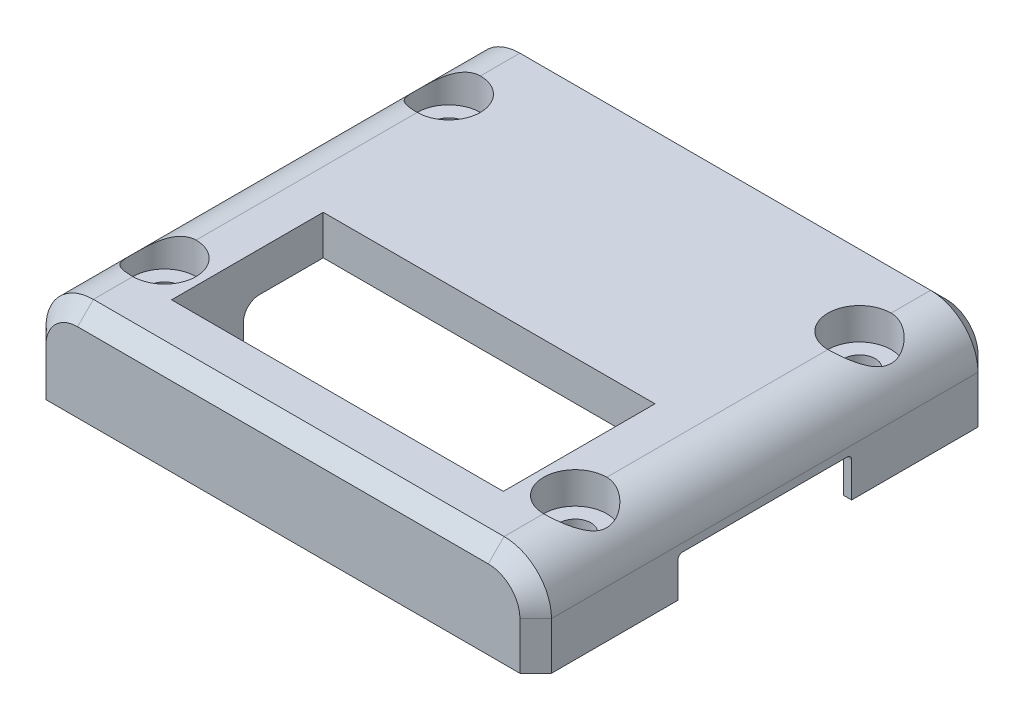
from build123d import *

# Parameters (mm, degrees)
SKETCH1_W           = 32
SKETCH1_H           = 29
BOSS_EXTRUDE1_DEPTH = 6
SKETCH2_R           = 1
CUT_EXTRUDE1_DEPTH  = 10
SKETCH3_W           = 21
SKETCH3_H           = 9.6
CUT_EXTRUDE2_DEPTH  = 10
SKETCH4_W           = 31
SKETCH4_H           = 27
CUT_EXTRUDE3_DEPTH  = 1
FILLET2_R           = 3
SKETCH5_R           = 2
CUT_EXTRUDE4_DEPTH  = 2
CHAMFER2_SIZE       = 1
SKETCH6_W           = 1
SKETCH6_H           = 11
CUT_EXTRUDE5_DEPTH  = 2.5
FILLET3_R           = 0.3
SKETCH7_W           = 31
SKETCH7_H           = 13
CUT_EXTRUDE6_DEPTH  = 2.5
FILLET4_R           = 1
SKETCH_1_W          = 21
SKETCH_1_H          = 12.05
CUT_EXTRUDE_1_DEPTH = 2.5
FILLET_1_R          = 1
SKETCH_2_W          = 11
SKETCH_2_H          = 2.5
CUT_EXTRUDE_2_DEPTH = 33.802439001
FILLET_2_R          = 0.3


with BuildPart() as part:
    # Sketch1 → Boss-Extrude1 (new body)
    with BuildSketch(Plane(origin=(0, 0, 0), x_dir=(1, 0, 0), z_dir=(0, 1, 0))):
        Rectangle(SKETCH1_W, SKETCH1_H)
    extrude(amount=BOSS_EXTRUDE1_DEPTH)

    # Sketch2 → Cut-Extrude1 (cut)
    with BuildSketch(Plane(origin=(0, 6, 0), x_dir=(1, 0, 0), z_dir=(0, 1, 0))):
        with Locations(Location((-13, 9, 0), (0, 0, 270))):
            Circle(SKETCH2_R)
        with Locations(Location((13, 9, 0), (0, 0, 270))):
            Circle(SKETCH2_R)
        with Locations(Location((13, -9, 0), (0, 0, 270))):
            Circle(SKETCH2_R)
        with Locations(Location((-13, -9, 0), (0, 0, 270))):
            Circle(SKETCH2_R)
    extrude(amount=-CUT_EXTRUDE1_DEPTH, mode=Mode.SUBTRACT)

    # Sketch3 → Cut-Extrude2 (cut)
    with BuildSketch(Plane(origin=(0, 6, 0), x_dir=(1, 0, 0), z_dir=(0, 1, 0))):
        with Locations((0, -6.25)):
            Rectangle(SKETCH3_W, SKETCH3_H)
    extrude(amount=-CUT_EXTRUDE2_DEPTH, mode=Mode.SUBTRACT)

    # Sketch4 → Cut-Extrude3 (cut)
    with BuildSketch(Plane.XZ):
        Rectangle(SKETCH4_W, SKETCH4_H)
    extrude(amount=-CUT_EXTRUDE3_DEPTH, mode=Mode.SUBTRACT)

    # Fillet2
    # the kernel refuses this fillet: 3 mm, written as the material it takes off along each edge
    with BuildSketch(Plane(origin=(16, 6, 22), x_dir=(0, -1, 0), z_dir=(0, 0, -1)), Plane(origin=(-16, 6, -22), x_dir=(0, -1, 0), z_dir=(0, 0, 1))) as fillet2_piece_1:
        with BuildLine():
            CenterArc((FILLET2_R, FILLET2_R), FILLET2_R, 180, 90)
            Line((0, FILLET2_R), (0, 0))
            Line((0, 0), (FILLET2_R, 0))
        make_face()
    extrude(amount=44, mode=Mode.SUBTRACT)

    # Sketch5 → Cut-Extrude4 (cut)
    with BuildSketch(Plane(origin=(0, 6, 0), x_dir=(1, 0, 0), z_dir=(0, 1, 0))):
        with Locations(Location((-13, 9, 0), (0, 0, 270))):
            Circle(SKETCH5_R)
        with Locations(Location((13, 9, 0), (0, 0, 270))):
            Circle(SKETCH5_R)
        with Locations(Location((13, -9, 0), (0, 0, 270))):
            Circle(SKETCH5_R)
        with Locations(Location((-13, -9, 0), (0, 0, 270))):
            Circle(SKETCH5_R)
    extrude(amount=-CUT_EXTRUDE4_DEPTH, mode=Mode.SUBTRACT)

    # Chamfer2
    chamfer2_edges = [part.edges().sort_by_distance(p)[0] for p in [
        (16, 1.5, 14.5),
        (15.121320344, 5.121320344, 14.5),
        (-15.121320344, 5.121320344, 14.5),
        (-16, 1.5, 14.5),
        (-16, 1.5, -14.5),
        (0, 6, -14.5),
        (16, 1.5, -14.5),
        (15.121320344, 5.121320344, -14.5),
        (-15.121320344, 5.121320344, -14.5),
        (0, 6, 14.5),
    ]]
    chamfer(chamfer2_edges, length=CHAMFER2_SIZE)

    # Sketch6 → Cut-Extrude5 (cut)
    with BuildSketch(Plane.XZ):
        with Locations((-15.5, 0)):
            Rectangle(SKETCH6_W, SKETCH6_H)
        with Locations((15.5, 0)):
            Rectangle(SKETCH6_W, SKETCH6_H)
    extrude(amount=-CUT_EXTRUDE5_DEPTH, mode=Mode.SUBTRACT)

    # Fillet3
    fillet3_edges = [part.edges().sort_by_distance(p)[0] for p in [
        (-15.5, 2.5, 5.5),
        (-15.5, 2.5, -5.5),
        (15.5, 2.5, -5.5),
        (15.5, 2.5, 5.5),
    ]]
    fillet(fillet3_edges, radius=FILLET3_R)

    # Sketch7 → Cut-Extrude6 (cut)
    with BuildSketch(Plane.XZ.offset(-1)):
        Rectangle(SKETCH7_W, SKETCH7_H)
    extrude(amount=-CUT_EXTRUDE6_DEPTH, mode=Mode.SUBTRACT)

    # Fillet4
    fillet4_edges = [part.edges().sort_by_distance(p)[0] for p in [
        (-13, 3.5, 6.5),
        (13, 3.5, 6.5),
        (0, 3.5, -6.5),
    ]]
    fillet(fillet4_edges, radius=FILLET4_R)

    # Эскиз1 → Вырез-Вытянуть1 (cut)
    with BuildSketch(Plane.XZ.offset(-1)):
        with Locations((0, -7.475)):
            Rectangle(SKETCH_1_W, SKETCH_1_H)
    extrude(amount=-CUT_EXTRUDE_1_DEPTH, mode=Mode.SUBTRACT)

    # Скругление1
    fillet_1_edges = [part.edges().sort_by_distance(p)[0] for p in [
        (10.5, 3.5, -9.5),
        (-10.5, 3.5, -9.5),
    ]]
    fillet(fillet_1_edges, radius=FILLET_1_R)

    # Эскиз2 → Вырез-Вытянуть2 (cut, through all)
    with BuildSketch(Plane.XY.offset(-13.5)):
        with Locations((0, 1.25)):
            Rectangle(SKETCH_2_W, SKETCH_2_H)
    extrude(amount=-CUT_EXTRUDE_2_DEPTH, mode=Mode.SUBTRACT)

    # Скругление2
    fillet_2_edges = [part.edges().sort_by_distance(p)[0] for p in [
        (5.5, 2.5, -14),
        (-5.5, 2.5, -14),
    ]]
    fillet(fillet_2_edges, radius=FILLET_2_R)


solid = part.part
